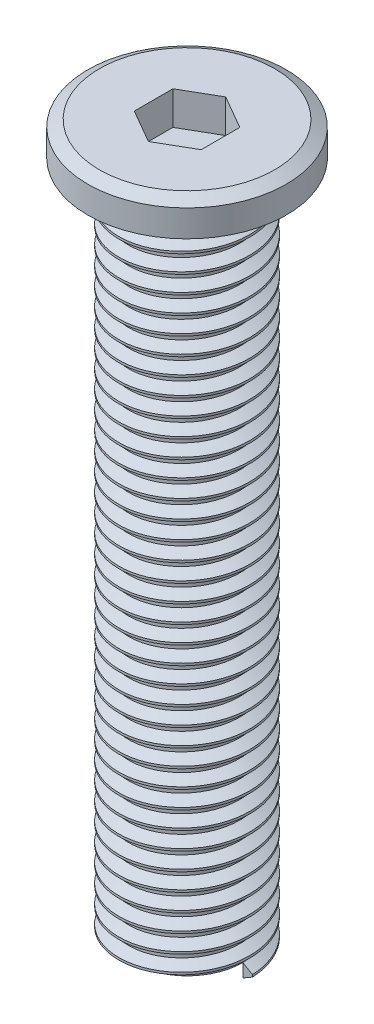
from build123d import *
from build123d.topology import SkipClean

# Parameters (mm, degrees)
SKETCH1_R           = 4.45
BOSS_EXTRUDE1_DEPTH = 1.5
CHAMFER2_SIZE       = 0.3
CHAMFER2_SIZE2      = 0.519615242
CUT_EXTRUDE1_DEPTH  = 3
SKETCH3_R           = 2.5
BOSS_EXTRUDE2_DEPTH = 30
THREAD1_PITCH       = 0.8


with BuildPart() as part:
    # Sketch1 → Boss-Extrude1 (new body)
    with BuildSketch(Plane(origin=(0, 0, 0), x_dir=(1, 0, 0), z_dir=(0, 1, 0))):
        with Locations(Location((0, 0, 0), (0, 0, 270))):
            Circle(SKETCH1_R)
    extrude(amount=BOSS_EXTRUDE1_DEPTH)

    # Chamfer2
    chamfer2_edges = [part.edges().sort_by_distance(p)[0] for p in [
        (0, 1.5, -4.45),
    ]]
    chamfer2_side = [part.faces().sort_by_distance(p)[0] for p in [
        (0, 0.75, -4.45),
    ]]
    chamfer(chamfer2_edges, length=CHAMFER2_SIZE, length2=CHAMFER2_SIZE2, reference=chamfer2_side[0])

    # Sketch8 → Cut-Extrude1 (cut)
    with BuildSketch(Plane(origin=(0, 1.5, 0), x_dir=(1, 0, 0), z_dir=(0, 1, 0))):
        Polygon((0, 1.732050808), (-1.5, 0.866025404), (-1.5, -0.866025404), (0, -1.732050808), (1.5, -0.866025404), (1.5, 0.866025404), align=None)
    extrude(amount=-CUT_EXTRUDE1_DEPTH, mode=Mode.SUBTRACT)

    # Sketch3 → Boss-Extrude2 (add)
    with BuildSketch(Plane.XZ):
        with Locations(Location((0, 0, 0), (0, 0, 90))):
            Circle(SKETCH3_R)
    extrude(amount=BOSS_EXTRUDE2_DEPTH)

    # Thread1: arcs per turn and ends read off the stored shape
    # Thread1: the profile of Thread Profile2 profile screwed along a right-hand helix through 37.5 turns, 8 arcs to a turn; built about Z, then put on its axis
    with SkipClean():  # the faces are left unmerged after this step: merging them gives an invalid solid
        thread1_z = Axis((0, 0, 0), (0, 0, 1))
        thread1_corners = [(2.4997, 0, -0.000173205), (2.9330127, 0, 0.249999999), (2.9330127, 0, 0.349999999), (2.4997, 0, 0.600173203)]
        with BuildLine(mode=Mode.PRIVATE) as thread1_profile:
            Line(thread1_corners[0], thread1_corners[1])
            Line(thread1_corners[1], thread1_corners[2])
            Line(thread1_corners[2], thread1_corners[3])
            Line(thread1_corners[3], thread1_corners[0])
        thread1_cap = Face(thread1_profile.wire())
        thread1_turn_angles = [0, 22.5, 45, 67.5, 90, 112.5, 135, 157.5, 180, 202.5, 225, 247.5, 270, 292.5, 315, 337.5, 360]
        thread1_turn_weights = [1, 0.9238795325112867, 1, 0.9238795325112867, 1, 0.9238795325112867, 1, 0.9238795325112867, 1, 0.9238795325112867, 1, 0.9238795325112867, 1, 0.9238795325112867, 1, 0.9238795325112867, 1]
        thread1_turn_rails = [Edge.make_bspline([Vector(p[0], p[1], 0).rotate(thread1_z, thread1_turn_angles[k]) / thread1_turn_weights[k] + Vector(0, 0, p[2] + THREAD1_PITCH * thread1_turn_angles[k] / 360) for k in range(17)], [0, 0, 0, 1, 1, 2, 2, 3, 3, 4, 4, 5, 5, 6, 6, 7, 7, 8, 8, 8], 2, thread1_turn_weights) for p in thread1_corners]
        thread1_turn_sides = [Face.make_surface_from_curves(thread1_turn_rails[p[0]], thread1_turn_rails[p[1]]) for p in [(0, 1), (1, 2), (2, 3), (3, 0)]]
        thread1_last_angles = [13320, 13342.5, 13365, 13387.5, 13410, 13432.5, 13455, 13477.5, 13500]
        thread1_last_weights = [1, 0.9238795325112867, 1, 0.9238795325112867, 1, 0.9238795325112867, 1, 0.9238795325112867, 1]
        thread1_last_rails = [Edge.make_bspline([Vector(p[0], p[1], 0).rotate(thread1_z, thread1_last_angles[k]) / thread1_last_weights[k] + Vector(0, 0, p[2] + THREAD1_PITCH * thread1_last_angles[k] / 360) for k in range(9)], [0, 0, 0, 1, 1, 2, 2, 3, 3, 4, 4, 4], 2, thread1_last_weights) for p in thread1_corners]
        thread1_last_sides = [Face.make_surface_from_curves(thread1_last_rails[p[0]], thread1_last_rails[p[1]]) for p in [(0, 1), (1, 2), (2, 3), (3, 0)]]
        thread1 = Plane(origin=(0, 0, 0), x_dir=(-1, 0, 0), z_dir=(0, -1, 0)) * Solid(Shell([*[p.moved(Location((0, 0, THREAD1_PITCH * i))) for i in range(37) for p in thread1_turn_sides], *thread1_last_sides, thread1_cap, thread1_cap.rotate(thread1_z, 13500).moved(Location((0, 0, THREAD1_PITCH * 13500 / 360)))]))
        add(thread1)


solid = part.part
